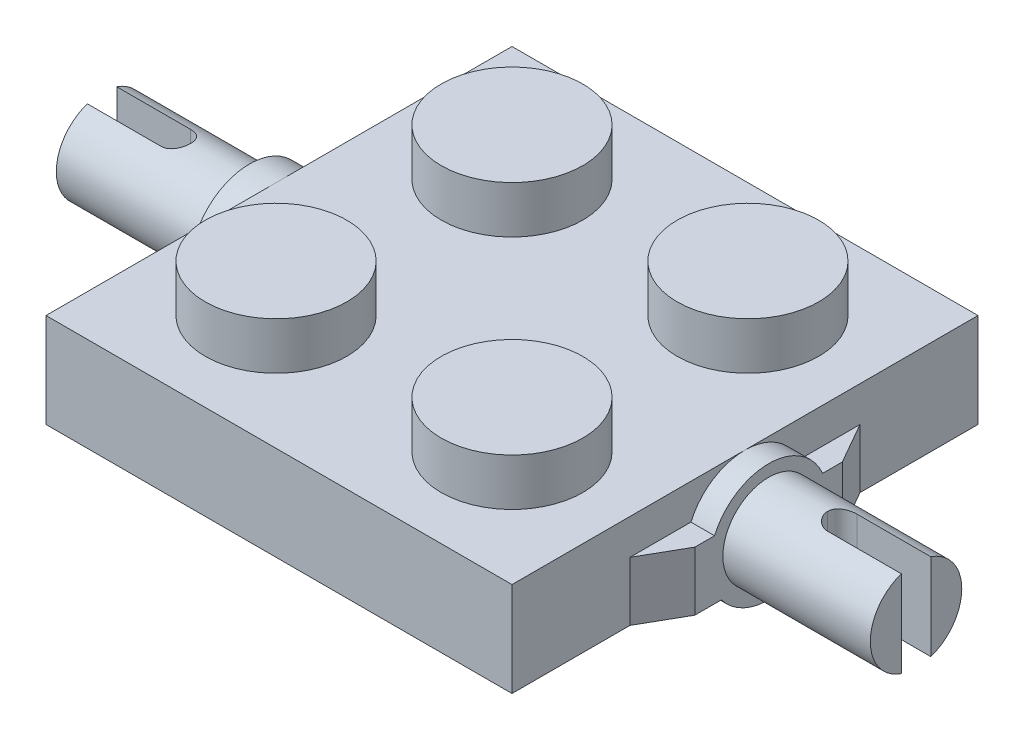
from build123d import *

# Parameters (mm, degrees)
SKETCH1_W                = 15.8
SKETCH1_H                = 3.2
BOSS_EXTRUDE1_DEPTH      = 15.8
SKETCH2_R                = 2.4
BOSS_EXTRUDE2_DEPTH      = 1.6
LPATTERN1_COUNT          = 2
LPATTERN1_PITCH          = 8
LPATTERN1_COUNT_DIR2     = 4
LPATTERN1_PITCH_DIR2     = 8
SHELL1_T                 = -1.2
SKETCH4_R                = 3.25
SKETCH4_R_2              = 2.4
BOSS_EXTRUDE3_DEPTH      = 1.8
BOSS_EXTRUDE4_REACH      = 24.042
BOSS_EXTRUDE4_END_RADIUS = 3.25
SKETCH6_W                = 1.1
SKETCH6_H                = 2
MIRROR1_DEPTH            = 2
BOSS_EXTRUDE6_DEPTH      = 2
BOSS_EXTRUDE7_START      = -0.3
SKETCH9_R                = 2
BOSS_EXTRUDE7_DEPTH      = 1
SKETCH10_R               = 1.55
BOSS_EXTRUDE8_DEPTH      = 5
CUT_EXTRUDE1_START       = -3
CUT_EXTRUDE1_DEPTH       = 3
FILLET1_R                = 0.5
FILLET1_OF_MIRROR2_R     = 0.5


# Read off the part's stored shape, not the designer's step: Mirror1
with BuildPart() as part:
    # Sketch1 → Boss-Extrude1 (new body)
    with BuildSketch(Plane.XY):
        with Locations((7.9, 1.6)):
            Rectangle(SKETCH1_W, SKETCH1_H)
    extrude(amount=-BOSS_EXTRUDE1_DEPTH)

    # Sketch2 → Boss-Extrude2 (add)
    with BuildSketch(Plane(origin=(0, 3.2, 0), x_dir=(1, 0, 0), z_dir=(0, 1, 0))):
        with Locations(Location((3.9, 3.9, 0), (0, 0, 270))):
            Circle(SKETCH2_R)
    boss_extrude2 = extrude(amount=BOSS_EXTRUDE2_DEPTH)

    # LPattern1: Boss-Extrude2 2 × 4, 4 skipped
    with Locations(*[(j * LPATTERN1_PITCH_DIR2, 0, -i * LPATTERN1_PITCH) for i in range(LPATTERN1_COUNT) for j in range(LPATTERN1_COUNT_DIR2) if (i, j) not in ((0, 0), (0, 2), (0, 3), (1, 2), (1, 3))]):
        add(boss_extrude2)

    # Shell1
    shell1_openings = [part.faces().sort_by_distance(p)[0] for p in [
        (7.9, 0, -7.9),
    ]]
    offset(amount=SHELL1_T, openings=shell1_openings, kind=Kind.INTERSECTION)

    # Sketch4 → Boss-Extrude3 (add)
    with BuildSketch(Plane.XZ.offset(-2)):
        with Locations(Location((7.9, -7.9, 0), (0, 0, 90))):
            Circle(SKETCH4_R)
        with Locations(Location((7.9, -7.9, 0), (0, 0, 270))):
            Circle(SKETCH4_R_2, mode=Mode.SUBTRACT)
    extrude(amount=BOSS_EXTRUDE3_DEPTH)

    # Boss-Extrude4: up to this cylinder (the profile starts outside it)
    boss_extrude4_end = Plane(origin=(7.9, 1, -7.9), z_dir=(0, 1, 0)) * Cylinder(BOSS_EXTRUDE4_END_RADIUS, 55.584, mode=Mode.PRIVATE)
    # Sketch6 → Boss-Extrude4 (add, up to the surface)
    with BuildSketch(Plane.ZY.offset(-14.6), mode=Mode.PRIVATE) as boss_extrude4_sk1:
        with Locations((-8.05, 1)):
            Rectangle(SKETCH6_W, SKETCH6_H)
    boss_extrude4_tool1 = extrude(boss_extrude4_sk1.sketch, amount=BOSS_EXTRUDE4_REACH, mode=Mode.PRIVATE) - boss_extrude4_end
    add(boss_extrude4_tool1.solids().sort_by_distance((14.6, 1, -8.05))[0])

    # Mirror1 outline → Mirror1 (add)
    with BuildSketch(Plane(origin=(0, 0, 0), x_dir=(1, 0, 0), z_dir=(0, 1, 0))):
        with BuildLine():
            Line((1.2, 8.6), (1.2, 7.5))
            Line((1.2, 7.5), (4.674709315, 7.5))
            ThreePointArc((4.674709315, 7.5), (4.653565784, 8.052200126), (4.726279785, 8.6))
            Line((4.726279785, 8.6), (1.2, 8.6))
        make_face()
    extrude(amount=MIRROR1_DEPTH)

    # Sketch8 → Boss-Extrude6 (add)
    with BuildSketch(Plane(origin=(0, 0, 0), x_dir=(-1, 0, 0), z_dir=(0, -1, 0))):
        Polygon((1, 10.4), (0, 12.15), (0, 3.65), (1, 5.4), (1, 6.4), (0.3, 6.4), (0.3, 9.4), (1, 9.4), align=None)
    boss_extrude6 = extrude(amount=-BOSS_EXTRUDE6_DEPTH)

    # Sketch9 → Boss-Extrude7 (add)
    with BuildSketch(Plane.ZY.offset(0.3).offset(BOSS_EXTRUDE7_START)):
        with Locations((-7.9, 1.2)):
            Circle(SKETCH9_R)
    boss_extrude7 = extrude(amount=BOSS_EXTRUDE7_DEPTH)

    # Sketch10 → Boss-Extrude8 (add)
    with BuildSketch(Plane.ZY.offset(1)):
        with Locations((-7.9, 1.25)):
            Circle(SKETCH10_R)
    boss_extrude8 = extrude(amount=BOSS_EXTRUDE8_DEPTH)

    # Sketch11 → Cut-Extrude1 (cut)
    with BuildSketch(Plane.ZY.offset(6).offset(CUT_EXTRUDE1_START)):
        with BuildLine():
            Line((-8.4, 2.717140075), (-8.4, -0.217140075))
            ThreePointArc((-8.4, -0.217140075), (-7.9, -0.3), (-7.4, -0.217140075))
            Line((-7.4, -0.217140075), (-7.4, 2.717140075))
            ThreePointArc((-7.4, 2.717140075), (-7.9, 2.8), (-8.4, 2.717140075))
        make_face()
    cut_extrude1 = extrude(amount=CUT_EXTRUDE1_DEPTH, mode=Mode.SUBTRACT)

    # Fillet1
    fillet1_edges = [part.edges().sort_by_distance(p)[0] for p in [
        (-3, 1.25, -8.4),
        (-3, 1.25, -7.4),
    ]]
    fillet(fillet1_edges, radius=FILLET1_R - 0.0001)  # a hair under: the kernel refuses the full size

    # Mirror2: Boss-Extrude6, Boss-Extrude7, Boss-Extrude8, Cut-Extrude1 across plane
    add(boss_extrude6.mirror(Plane(origin=(7.8, 0, 0), x_dir=(0, 0, 1), z_dir=(1, 0, 0))))
    add(boss_extrude7.mirror(Plane(origin=(7.8, 0, 0), x_dir=(0, 0, 1), z_dir=(1, 0, 0))))
    add(boss_extrude8.mirror(Plane(origin=(7.8, 0, 0), x_dir=(0, 0, 1), z_dir=(1, 0, 0))))
    add(cut_extrude1.mirror(Plane(origin=(7.8, 0, 0), x_dir=(0, 0, 1), z_dir=(1, 0, 0))), mode=Mode.SUBTRACT)

    # Fillet1 of Mirror2
    fillet1_of_mirror2_edges = [part.edges().sort_by_distance(p)[0] for p in [
        (18.6, 1.25, -8.4),
        (18.6, 1.25, -7.4),
    ]]
    fillet(fillet1_of_mirror2_edges, radius=FILLET1_OF_MIRROR2_R - 0.0001)  # a hair under: the kernel refuses the full size


solid = part.part
